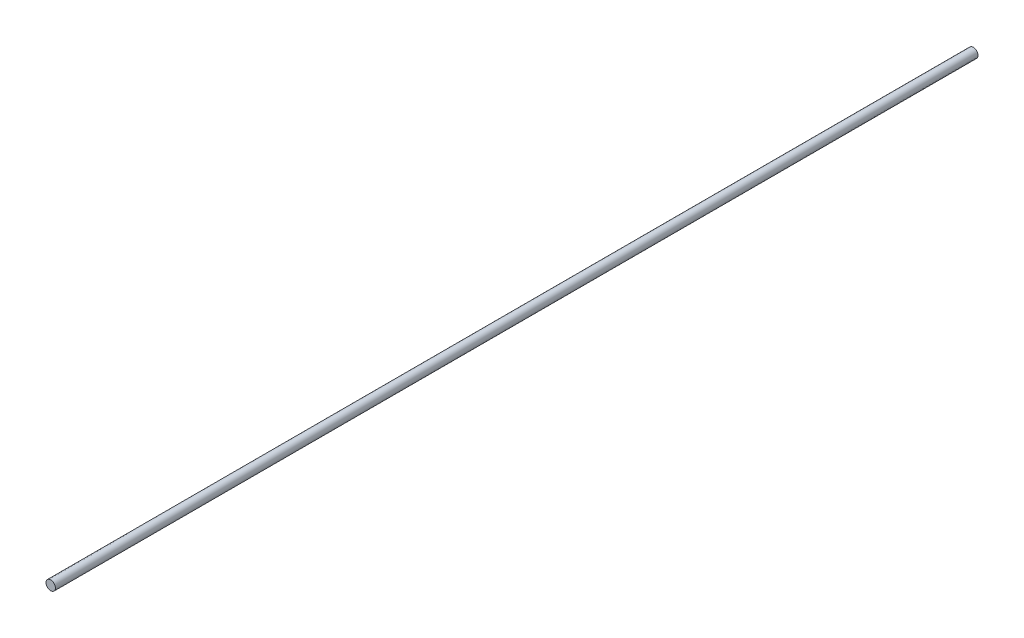
from build123d import *

# Parameters (mm, degrees)
SKETCH1_R = 2.5
ROD_DEPTH = 489


with BuildPart() as part:
    # Sketch1 → Rod (new body)
    with BuildSketch(Plane.XY):
        Circle(SKETCH1_R)
    extrude(amount=ROD_DEPTH)


solid = part.part
